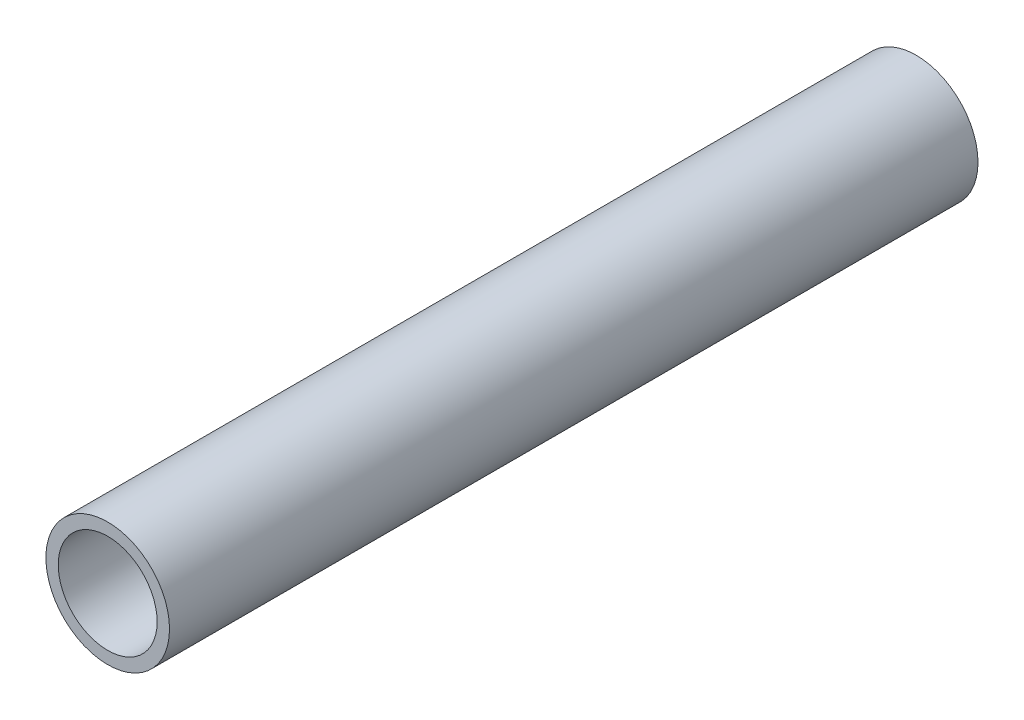
from build123d import *

# Parameters (mm, degrees)
BOSS_EXTRUDE1_DEPTH      = 18
BOSS_EXTRUDE1_DEPTH_BACK = 145.5
SKETCH1_R                = 12.5
SKETCH1_R_2              = 10


with BuildPart() as part:
    # Sketch1 → Boss-Extrude1 (new, two sides: drawn at the far end of the back side and taken through both)
    with BuildSketch(Plane.XY.offset(-BOSS_EXTRUDE1_DEPTH_BACK)):
        Circle(SKETCH1_R)
        Circle(SKETCH1_R_2, mode=Mode.SUBTRACT)
    extrude(amount=BOSS_EXTRUDE1_DEPTH + BOSS_EXTRUDE1_DEPTH_BACK)


solid = part.part
